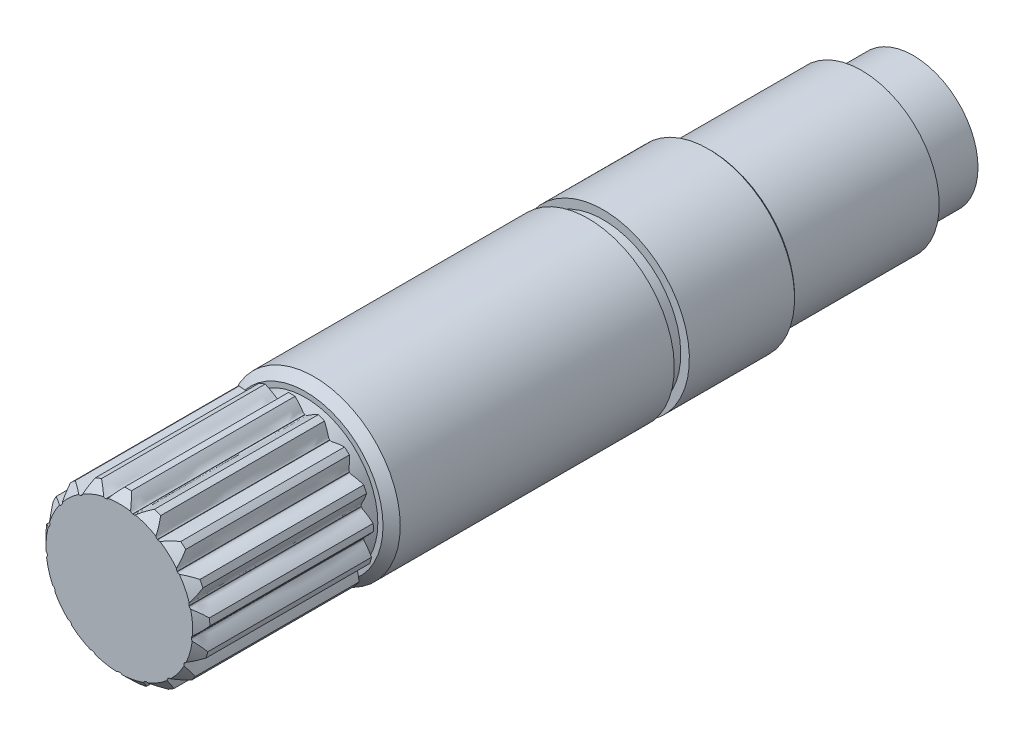
from build123d import *
from OCP.BRepFilletAPI import BRepFilletAPI_MakeChamfer

# Parameters (mm, degrees)
SKETCH12_R              = 10
SHAFT_DEPTH             = 21.5
SKETCH13_R              = 8.398146
MOTOR_SIDE_RELIEF_DEPTH = 1.587
MOTOR_SPLINE_DEPTH      = 20
CHAMFER3_SIZE           = 1
SKETCH23_W              = 1
SKETCH23_H              = 1.75
CHAMFER4_SIZE           = 1
CHAMFER4_SIZE2          = 0.466307658
CHAMFER5_SIZE           = 0.25
CHAMFER6_SIZE           = 1


with BuildPart() as part:
    # Sketch12 → Shaft (new, symmetric)
    with BuildSketch(Plane.XY):
        Circle(SKETCH12_R)
    extrude(amount=SHAFT_DEPTH, both=True)

    # Sketch13 → Motor side relief (add)
    with BuildSketch(Plane.XY.offset(21.5)):
        Circle(SKETCH13_R)
    extrude(amount=MOTOR_SIDE_RELIEF_DEPTH)

    # Sketch15 → Motor spline (add)
    with BuildSketch(Plane.XY.offset(23.087)):
        with BuildLine():
            Line((4.440221189, 7.12834427), (4.421054163, 7.140247638))
            Line((4.421054163, 7.140247638), (4.401855226, 7.152099468))
            add(Edge.make_bspline(
                [(4.401855226, 7.152099468), (4.346074893, 7.18643022), (4.303271658, 7.233316124), (4.247234181, 7.342487901), (4.237804809, 7.408052721), (4.194006084, 7.602023317), (4.124459498, 7.868486133), (3.983153486, 8.288727427), (3.862105942, 8.580360972), (3.794372065, 8.728433243)],
                knots=[0, 0, 0, 0, 0.125, 0.125, 0.25, 0.25, 0.5, 0.75, 1, 1, 1, 1], degree=3, weights=[1, 1, 1, 1, 1, 1, 1, 1, 1, 1]))
            ThreePointArc((3.794372065, 8.728433243), (3.438117558, 8.874804443), (3.076232661, 9.006641931))
            add(Edge.make_bspline(
                [(3.076232661, 9.006641931), (2.926421077, 8.942847219), (2.64049232, 8.808876568), (2.252952462, 8.593511743), (2.022042097, 8.443446649), (1.858997303, 8.329607659), (1.80785818, 8.287507199), (1.692897433, 8.244580486), (1.629678632, 8.238767738), (1.56532799, 8.250975974)],
                knots=[0, 0, 0, 0, 0.25, 0.5, 0.75, 0.75, 0.875, 0.875, 1, 1, 1, 1], degree=3, weights=[1, 1, 1, 1, 1, 1, 1, 1, 1, 1]))
            Line((1.56532799, 8.250975974), (1.543155278, 8.255151605))
            Line((1.543155278, 8.255151605), (1.520971428, 8.259267652))
            add(Edge.make_bspline(
                [(1.520971428, 8.259267652), (1.456556118, 8.271129944), (1.399706148, 8.299387436), (1.308015362, 8.380944015), (1.27553799, 8.438675107), (1.164626634, 8.603725376), (1.003518902, 8.827071428), (0.719946305, 9.167889145), (0.501722644, 9.39610191), (0.38507281, 9.509706892)],
                knots=[0, 0, 0, 0, 0.125, 0.125, 0.25, 0.25, 0.5, 0.75, 1, 1, 1, 1], degree=3, weights=[1, 1, 1, 1, 1, 1, 1, 1, 1, 1]))
            ThreePointArc((0.38507281, 9.509706892), (0, 9.5175), (-0.38507281, 9.509706892))
            add(Edge.make_bspline(
                [(-0.38507281, 9.509706892), (-0.501722644, 9.39610191), (-0.719947489, 9.167888617), (-1.003518896, 8.827071355), (-1.164626634, 8.603725376), (-1.27553799, 8.438675107), (-1.308015362, 8.380944015), (-1.399706148, 8.299387436), (-1.456556118, 8.271129944), (-1.520971428, 8.259267652)],
                knots=[0, 0, 0, 0, 0.25, 0.5, 0.75, 0.75, 0.875, 0.875, 1, 1, 1, 1], degree=3, weights=[1, 1, 1, 1, 1, 1, 1, 1, 1, 1]))
            Line((-1.520971428, 8.259267652), (-1.543155278, 8.255151605))
            Line((-1.543155278, 8.255151605), (-1.56532799, 8.250975974))
            add(Edge.make_bspline(
                [(-1.56532799, 8.250975974), (-1.629678632, 8.238767738), (-1.692897433, 8.244580486), (-1.80785818, 8.287507199), (-1.858997303, 8.329607659), (-2.022042097, 8.443446649), (-2.252952482, 8.593511814), (-2.640493614, 8.808876633), (-2.926421077, 8.942847219), (-3.076232661, 9.006641931)],
                knots=[0, 0, 0, 0, 0.125, 0.125, 0.25, 0.25, 0.5, 0.75, 1, 1, 1, 1], degree=3, weights=[1, 1, 1, 1, 1, 1, 1, 1, 1, 1]))
            ThreePointArc((-3.076232661, 9.006641931), (-3.438117558, 8.874804443), (-3.794372065, 8.728433243))
            add(Edge.make_bspline(
                [(-3.794372065, 8.728433243), (-3.862105942, 8.580360972), (-3.9831544, 8.288726508), (-4.124459466, 7.868486068), (-4.194006084, 7.602023317), (-4.237804809, 7.408052721), (-4.247234181, 7.342487901), (-4.303271658, 7.233316124), (-4.346074893, 7.18643022), (-4.401855226, 7.152099468)],
                knots=[0, 0, 0, 0, 0.25, 0.5, 0.75, 0.75, 0.875, 0.875, 1, 1, 1, 1], degree=3, weights=[1, 1, 1, 1, 1, 1, 1, 1, 1, 1]))
            Line((-4.401855226, 7.152099468), (-4.421054163, 7.140247638))
            Line((-4.421054163, 7.140247638), (-4.440221189, 7.12834427))
            add(Edge.make_bspline(
                [(-4.440221189, 7.12834427), (-4.495816252, 7.093714296), (-4.556865835, 7.076297257), (-4.679570456, 7.074796613), (-4.742464709, 7.095580541), (-4.935622837, 7.142833664), (-5.20515015, 7.199350811), (-5.644320239, 7.260176519), (-5.959335416, 7.281811458), (-6.122075865, 7.287180068)],
                knots=[0, 0, 0, 0, 0.125, 0.125, 0.25, 0.25, 0.5, 0.75, 1, 1, 1, 1], degree=3, weights=[1, 1, 1, 1, 1, 1, 1, 1, 1, 1]))
            ThreePointArc((-6.122075865, 7.287180068), (-6.411898288, 7.03351737), (-6.691220346, 6.768336319))
            add(Edge.make_bspline(
                [(-6.691220346, 6.768336319), (-6.700890432, 6.605794739), (-6.708414237, 6.290125953), (-6.688368931, 5.847218136), (-6.656961773, 5.573625885), (-6.627732607, 5.376931766), (-6.612840489, 5.312388111), (-6.625656486, 5.190345388), (-6.648632171, 5.131163273), (-6.688244085, 5.07900062)],
                knots=[0, 0, 0, 0, 0.25, 0.5, 0.75, 0.75, 0.875, 0.875, 1, 1, 1, 1], degree=3, weights=[1, 1, 1, 1, 1, 1, 1, 1, 1, 1]))
            Line((-6.688244085, 5.07900062), (-6.701865185, 5.061013661))
            Line((-6.701865185, 5.061013661), (-6.715437913, 5.042990172))
            add(Edge.make_bspline(
                [(-6.715437913, 5.042990172), (-6.754768975, 4.990615431), (-6.805404256, 4.952320872), (-6.919280812, 4.906595542), (-6.985435977, 4.903255953), (-7.182620365, 4.877541414), (-7.454363447, 4.832877588), (-7.88585014, 4.730949337), (-8.187408485, 4.637326709), (-8.3410988, 4.583544158)],
                knots=[0, 0, 0, 0, 0.125, 0.125, 0.25, 0.25, 0.5, 0.75, 1, 1, 1, 1], degree=3, weights=[1, 1, 1, 1, 1, 1, 1, 1, 1, 1]))
            ThreePointArc((-8.3410988, 4.583544158), (-8.519716625, 4.242314801), (-8.684382243, 3.89413807))
            add(Edge.make_bspline(
                [(-8.684382243, 3.89413807), (-8.634682538, 3.739079323), (-8.527665559, 3.442009035), (-8.34897711, 3.036250994), (-8.220857887, 2.792479392), (-8.12254839, 2.619626382), (-8.085346046, 2.564820869), (-8.05320969, 2.446389747), (-8.053254834, 2.382904293), (-8.071348519, 2.319954594)],
                knots=[0, 0, 0, 0, 0.25, 0.5, 0.75, 0.75, 0.875, 0.875, 1, 1, 1, 1], degree=3, weights=[1, 1, 1, 1, 1, 1, 1, 1, 1, 1]))
            Line((-8.071348519, 2.319954594), (-8.077552178, 2.298261745))
            Line((-8.077552178, 2.298261745), (-8.083697534, 2.276552308))
            add(Edge.make_bspline(
                [(-8.083697534, 2.276552308), (-8.101452719, 2.213506297), (-8.134835122, 2.159506112), (-8.224503954, 2.075731554), (-8.284985409, 2.048719478), (-8.459565212, 1.953510168), (-8.696823654, 1.813697467), (-9.062352282, 1.562781232), (-9.30972667, 1.366545292), (-9.433610123, 1.260875211)],
                knots=[0, 0, 0, 0, 0.125, 0.125, 0.25, 0.25, 0.5, 0.75, 1, 1, 1, 1], degree=3, weights=[1, 1, 1, 1, 1, 1, 1, 1, 1, 1]))
            ThreePointArc((-9.433610123, 1.260875211), (-9.476900023, 0.878164111), (-9.504670196, 0.494014896))
            add(Edge.make_bspline(
                [(-9.504670196, 0.494014896), (-9.402312921, 0.367380525), (-9.195208395, 0.129029723), (-8.882009667, -0.184778668), (-8.67448159, -0.365806916), (-8.520369004, -0.491474062), (-8.465880817, -0.529139644), (-8.393132302, -0.627964385), (-8.370240806, -0.687179116), (-8.364372611, -0.752414155)],
                knots=[0, 0, 0, 0, 0.25, 0.5, 0.75, 0.75, 0.875, 0.875, 1, 1, 1, 1], degree=3, weights=[1, 1, 1, 1, 1, 1, 1, 1, 1, 1]))
            Line((-8.364372611, -0.752414155), (-8.36232099, -0.774883154))
            Line((-8.36232099, -0.774883154), (-8.360209011, -0.79734656))
            add(Edge.make_bspline(
                [(-8.360209011, -0.79734656), (-8.353990381, -0.862549127), (-8.365611428, -0.924961915), (-8.418962263, -1.035471482), (-8.465601653, -1.082507914), (-8.593998901, -1.234353451), (-8.764729637, -1.450432547), (-9.014933532, -1.816449138), (-9.174714682, -2.088795639), (-9.252060125, -2.23208192)],
                knots=[0, 0, 0, 0, 0.125, 0.125, 0.25, 0.25, 0.5, 0.75, 1, 1, 1, 1], degree=3, weights=[1, 1, 1, 1, 1, 1, 1, 1, 1, 1]))
            ThreePointArc((-9.252060125, -2.23208192), (-9.154175559, -2.604587508), (-9.041299772, -2.972827726))
            add(Edge.make_bspline(
                [(-9.041299772, -2.972827726), (-8.900108844, -3.053935048), (-8.620887383, -3.201375768), (-8.215477602, -3.380852948), (-7.956568487, -3.474688973), (-7.767466572, -3.53619821), (-7.703051473, -3.551636916), (-7.599515889, -3.617508448), (-7.556779376, -3.664455177), (-7.527741833, -3.723165203)],
                knots=[0, 0, 0, 0, 0.25, 0.5, 0.75, 0.75, 0.875, 0.875, 1, 1, 1, 1], degree=3, weights=[1, 1, 1, 1, 1, 1, 1, 1, 1, 1]))
            Line((-7.527741833, -3.723165203), (-7.517712015, -3.74337579))
            Line((-7.517712015, -3.74337579), (-7.507627934, -3.763559357))
            add(Edge.make_bspline(
                [(-7.507627934, -3.763559357), (-7.478275351, -3.822112512), (-7.466565555, -3.88450871), (-7.476393067, -4.006828357), (-7.502891484, -4.067536614), (-7.567765417, -4.255510796), (-7.648910315, -4.518673608), (-7.749998055, -4.950357987), (-7.800606636, -5.262033145), (-7.82096814, -5.423584019)],
                knots=[0, 0, 0, 0, 0.125, 0.125, 0.25, 0.25, 0.5, 0.75, 1, 1, 1, 1], degree=3, weights=[1, 1, 1, 1, 1, 1, 1, 1, 1, 1]))
            ThreePointArc((-7.82096814, -5.423584019), (-7.595128961, -5.735575152), (-7.356851714, -6.038173492))
            add(Edge.make_bspline(
                [(-7.356851714, -6.038173492), (-7.19589575, -6.062799771), (-6.882267761, -6.099417722), (-6.439399763, -6.120324303), (-6.164076721, -6.114295031), (-5.965524738, -6.103339195), (-5.899882343, -6.094465941), (-5.779542744, -6.118487949), (-5.722733018, -6.146826261), (-5.674447808, -6.19108216)],
                knots=[0, 0, 0, 0, 0.25, 0.5, 0.75, 0.75, 0.875, 0.875, 1, 1, 1, 1], degree=3, weights=[1, 1, 1, 1, 1, 1, 1, 1, 1, 1]))
            Line((-5.674447808, -6.19108216), (-5.657794375, -6.206304782))
            Line((-5.657794375, -6.206304782), (-5.641100105, -6.221482608))
            add(Edge.make_bspline(
                [(-5.641100105, -6.221482608), (-5.592577797, -6.265478423), (-5.559118631, -6.319431079), (-5.524095559, -6.437040859), (-5.526874245, -6.503221956), (-5.51946328, -6.701937828), (-5.50006327, -6.97664276), (-5.438382397, -7.415693559), (-5.37298344, -7.724603916), (-5.333611069, -7.882601043)],
                knots=[0, 0, 0, 0, 0.125, 0.125, 0.25, 0.25, 0.5, 0.75, 1, 1, 1, 1], degree=3, weights=[1, 1, 1, 1, 1, 1, 1, 1, 1, 1]))
            ThreePointArc((-5.333611069, -7.882601043), (-5.01031811, -8.091941589), (-4.678820066, -8.288030468))
            add(Edge.make_bspline(
                [(-4.678820066, -8.288030468), (-4.519837062, -8.252849789), (-4.214159742, -8.173699515), (-3.793645304, -8.033211947), (-3.539092238, -7.928131664), (-3.357905732, -7.846190402), (-3.29990141, -7.814203571), (-3.179010326, -7.793131749), (-3.115799855, -7.799034398), (-3.054788163, -7.822859165)],
                knots=[0, 0, 0, 0, 0.25, 0.5, 0.75, 0.75, 0.875, 0.875, 1, 1, 1, 1], degree=3, weights=[1, 1, 1, 1, 1, 1, 1, 1, 1, 1]))
            Line((-3.054788163, -7.822859165), (-3.033760254, -7.831037923))
            Line((-3.033760254, -7.831037923), (-3.012710447, -7.839160159))
            add(Edge.make_bspline(
                [(-3.012710447, -7.839160159), (-2.951571621, -7.862656755), (-2.900881931, -7.900879263), (-2.825738336, -7.997895325), (-2.804422014, -8.060611137), (-2.725727042, -8.24323102), (-2.608402205, -8.492377648), (-2.392283061, -8.879498624), (-2.219709058, -9.143924126), (-2.12592027, -9.277029118)],
                knots=[0, 0, 0, 0, 0.125, 0.125, 0.25, 0.25, 0.5, 0.75, 1, 1, 1, 1], degree=3, weights=[1, 1, 1, 1, 1, 1, 1, 1, 1, 1]))
            ThreePointArc((-2.12592027, -9.277029118), (-1.748836036, -9.355446476), (-1.368887842, -9.418543004))
            add(Edge.make_bspline(
                [(-1.368887842, -9.418543004), (-1.233349333, -9.328306713), (-0.976906098, -9.144077896), (-0.635538026, -8.861169804), (-0.436133737, -8.671230184), (-0.29678295, -8.529370118), (-0.254250507, -8.478589709), (-0.149134948, -8.415269923), (-0.088060657, -8.397939724), (-0.02256245, -8.398115692)],
                knots=[0, 0, 0, 0, 0.25, 0.5, 0.75, 0.75, 0.875, 0.875, 1, 1, 1, 1], degree=3, weights=[1, 1, 1, 1, 1, 1, 1, 1, 1, 1]))
            Line((-0.02256245, -8.398115692), (0, -8.398146))
            Line((0, -8.398146), (0.02256245, -8.398115692))
            add(Edge.make_bspline(
                [(0.02256245, -8.398115692), (0.088060657, -8.397939724), (0.149134948, -8.415269923), (0.254250507, -8.478589709), (0.29678295, -8.529370118), (0.436133737, -8.671230184), (0.635538032, -8.861169877), (0.976907359, -9.144078197), (1.233349333, -9.328306713), (1.368887842, -9.418543004)],
                knots=[0, 0, 0, 0, 0.125, 0.125, 0.25, 0.25, 0.5, 0.75, 1, 1, 1, 1], degree=3, weights=[1, 1, 1, 1, 1, 1, 1, 1, 1, 1]))
            ThreePointArc((1.368887842, -9.418543004), (1.748836036, -9.355446476), (2.12592027, -9.277029118))
            add(Edge.make_bspline(
                [(2.12592027, -9.277029118), (2.219709058, -9.143924126), (2.392284128, -8.879497888), (2.608402185, -8.492377578), (2.725727042, -8.24323102), (2.804422014, -8.060611137), (2.825738336, -7.997895325), (2.900881931, -7.900879263), (2.951571621, -7.862656755), (3.012710447, -7.839160159)],
                knots=[0, 0, 0, 0, 0.25, 0.5, 0.75, 0.75, 0.875, 0.875, 1, 1, 1, 1], degree=3, weights=[1, 1, 1, 1, 1, 1, 1, 1, 1, 1]))
            Line((3.012710447, -7.839160159), (3.033760254, -7.831037923))
            Line((3.033760254, -7.831037923), (3.054788163, -7.822859165))
            add(Edge.make_bspline(
                [(3.054788163, -7.822859165), (3.115799855, -7.799034398), (3.179010326, -7.793131749), (3.29990141, -7.814203571), (3.357905732, -7.846190402), (3.539092238, -7.928131664), (3.793645337, -8.033212013), (4.214161026, -8.17369934), (4.519837062, -8.252849789), (4.678820066, -8.288030468)],
                knots=[0, 0, 0, 0, 0.125, 0.125, 0.25, 0.25, 0.5, 0.75, 1, 1, 1, 1], degree=3, weights=[1, 1, 1, 1, 1, 1, 1, 1, 1, 1]))
            ThreePointArc((4.678820066, -8.288030468), (5.01031811, -8.091941589), (5.333611069, -7.882601043))
            add(Edge.make_bspline(
                [(5.333611069, -7.882601043), (5.37298344, -7.724603916), (5.438383126, -7.415692487), (5.500063226, -6.976642702), (5.51946328, -6.701937828), (5.526874245, -6.503221956), (5.524095559, -6.437040859), (5.559118631, -6.319431079), (5.592577797, -6.265478423), (5.641100105, -6.221482608)],
                knots=[0, 0, 0, 0, 0.25, 0.5, 0.75, 0.75, 0.875, 0.875, 1, 1, 1, 1], degree=3, weights=[1, 1, 1, 1, 1, 1, 1, 1, 1, 1]))
            Line((5.641100105, -6.221482608), (5.657794375, -6.206304782))
            Line((5.657794375, -6.206304782), (5.674447808, -6.19108216))
            add(Edge.make_bspline(
                [(5.674447808, -6.19108216), (5.722733018, -6.146826261), (5.779542744, -6.118487949), (5.899882343, -6.094465941), (5.965524738, -6.103339195), (6.164076721, -6.114295031), (6.439399817, -6.120324352), (6.882268896, -6.099417095), (7.19589575, -6.062799771), (7.356851714, -6.038173492)],
                knots=[0, 0, 0, 0, 0.125, 0.125, 0.25, 0.25, 0.5, 0.75, 1, 1, 1, 1], degree=3, weights=[1, 1, 1, 1, 1, 1, 1, 1, 1, 1]))
            ThreePointArc((7.356851714, -6.038173492), (7.595128961, -5.735575152), (7.82096814, -5.423584019))
            add(Edge.make_bspline(
                [(7.82096814, -5.423584019), (7.800606636, -5.262033145), (7.749998348, -4.950356724), (7.648910253, -4.51867357), (7.567765417, -4.255510796), (7.502891484, -4.067536614), (7.476393067, -4.006828357), (7.466565555, -3.88450871), (7.478275351, -3.822112512), (7.507627934, -3.763559357)],
                knots=[0, 0, 0, 0, 0.25, 0.5, 0.75, 0.75, 0.875, 0.875, 1, 1, 1, 1], degree=3, weights=[1, 1, 1, 1, 1, 1, 1, 1, 1, 1]))
            Line((7.507627934, -3.763559357), (7.517712015, -3.74337579))
            Line((7.517712015, -3.74337579), (7.527741833, -3.723165203))
            add(Edge.make_bspline(
                [(7.527741833, -3.723165203), (7.556779376, -3.664455177), (7.599515889, -3.617508448), (7.703051473, -3.551636916), (7.767466572, -3.53619821), (7.956568487, -3.474688973), (8.21547767, -3.380852974), (8.620888215, -3.201374774), (8.900108844, -3.053935048), (9.041299772, -2.972827726)],
                knots=[0, 0, 0, 0, 0.125, 0.125, 0.25, 0.25, 0.5, 0.75, 1, 1, 1, 1], degree=3, weights=[1, 1, 1, 1, 1, 1, 1, 1, 1, 1]))
            ThreePointArc((9.041299772, -2.972827726), (9.154175559, -2.604587508), (9.252060125, -2.23208192))
            add(Edge.make_bspline(
                [(9.252060125, -2.23208192), (9.174714682, -2.088795639), (9.014933348, -1.816447855), (8.764729565, -1.450432533), (8.593998901, -1.234353451), (8.465601653, -1.082507914), (8.418962263, -1.035471482), (8.365611428, -0.924961915), (8.353990381, -0.862549127), (8.360209011, -0.79734656)],
                knots=[0, 0, 0, 0, 0.25, 0.5, 0.75, 0.75, 0.875, 0.875, 1, 1, 1, 1], degree=3, weights=[1, 1, 1, 1, 1, 1, 1, 1, 1, 1]))
            Line((8.360209011, -0.79734656), (8.36232099, -0.774883154))
            Line((8.36232099, -0.774883154), (8.364372611, -0.752414155))
            add(Edge.make_bspline(
                [(8.364372611, -0.752414155), (8.370240806, -0.687179116), (8.393132302, -0.627964385), (8.465880817, -0.529139644), (8.520369004, -0.491474062), (8.67448159, -0.365806916), (8.88200974, -0.184778668), (9.195208811, 0.12903095), (9.402312921, 0.367380525), (9.504670196, 0.494014896)],
                knots=[0, 0, 0, 0, 0.125, 0.125, 0.25, 0.25, 0.5, 0.75, 1, 1, 1, 1], degree=3, weights=[1, 1, 1, 1, 1, 1, 1, 1, 1, 1]))
            ThreePointArc((9.504670196, 0.494014896), (9.476900023, 0.878164111), (9.433610123, 1.260875211))
            add(Edge.make_bspline(
                [(9.433610123, 1.260875211), (9.30972667, 1.366545292), (9.062351647, 1.562782362), (8.696823583, 1.813697454), (8.459565212, 1.953510168), (8.284985409, 2.048719478), (8.224503954, 2.075731554), (8.134835122, 2.159506112), (8.101452719, 2.213506297), (8.083697534, 2.276552308)],
                knots=[0, 0, 0, 0, 0.25, 0.5, 0.75, 0.75, 0.875, 0.875, 1, 1, 1, 1], degree=3, weights=[1, 1, 1, 1, 1, 1, 1, 1, 1, 1]))
            Line((8.083697534, 2.276552308), (8.077552178, 2.298261745))
            Line((8.077552178, 2.298261745), (8.071348519, 2.319954594))
            add(Edge.make_bspline(
                [(8.071348519, 2.319954594), (8.053254834, 2.382904293), (8.05320969, 2.446389747), (8.085346046, 2.564820869), (8.12254839, 2.619626382), (8.220857887, 2.792479392), (8.348977178, 3.036251021), (8.527665504, 3.442010329), (8.634682538, 3.739079323), (8.684382243, 3.89413807)],
                knots=[0, 0, 0, 0, 0.125, 0.125, 0.25, 0.25, 0.5, 0.75, 1, 1, 1, 1], degree=3, weights=[1, 1, 1, 1, 1, 1, 1, 1, 1, 1]))
            ThreePointArc((8.684382243, 3.89413807), (8.519716625, 4.242314801), (8.3410988, 4.583544158))
            add(Edge.make_bspline(
                [(8.3410988, 4.583544158), (8.187408485, 4.637326709), (7.88584914, 4.730950162), (7.454363385, 4.83287755), (7.182620365, 4.877541414), (6.985435977, 4.903255953), (6.919280812, 4.906595542), (6.805404256, 4.952320872), (6.754768975, 4.990615431), (6.715437913, 5.042990172)],
                knots=[0, 0, 0, 0, 0.25, 0.5, 0.75, 0.75, 0.875, 0.875, 1, 1, 1, 1], degree=3, weights=[1, 1, 1, 1, 1, 1, 1, 1, 1, 1]))
            Line((6.715437913, 5.042990172), (6.701865185, 5.061013661))
            Line((6.701865185, 5.061013661), (6.688244085, 5.07900062))
            add(Edge.make_bspline(
                [(6.688244085, 5.07900062), (6.648632171, 5.131163273), (6.625656486, 5.190345388), (6.612840489, 5.312388111), (6.627732607, 5.376931766), (6.656961773, 5.573625885), (6.688368985, 5.847218185), (6.708413718, 6.290127141), (6.700890432, 6.605794739), (6.691220346, 6.768336319)],
                knots=[0, 0, 0, 0, 0.125, 0.125, 0.25, 0.25, 0.5, 0.75, 1, 1, 1, 1], degree=3, weights=[1, 1, 1, 1, 1, 1, 1, 1, 1, 1]))
            ThreePointArc((6.691220346, 6.768336319), (6.411898288, 7.03351737), (6.122075865, 7.287180068))
            add(Edge.make_bspline(
                [(6.122075865, 7.287180068), (5.959335416, 7.281811458), (5.644319009, 7.260176927), (5.205150106, 7.199350753), (4.935622837, 7.142833664), (4.742464709, 7.095580541), (4.679570456, 7.074796613), (4.556865835, 7.076297257), (4.495816252, 7.093714296), (4.440221189, 7.12834427)],
                knots=[0, 0, 0, 0, 0.25, 0.5, 0.75, 0.75, 0.875, 0.875, 1, 1, 1, 1], degree=3, weights=[1, 1, 1, 1, 1, 1, 1, 1, 1, 1]))
        make_face()
    extrude(amount=MOTOR_SPLINE_DEPTH)

    # Chamfer3
    chamfer3_edges = [part.edges().sort_by_distance(p)[0] for p in [
        (-10, 0, 21.5),
    ]]
    chamfer(chamfer3_edges, length=CHAMFER3_SIZE)

    # Sketch23 → snap ring (revolve, cut)
    with BuildSketch(Plane(origin=(0, 0, -31.5), x_dir=(-0.3181828922838932, -0.9480293492597455, 0), z_dir=(-0.9480293492597455, 0.3181828922838932, 0))):
        with Locations((9.5, 19.32924121)):
            Rectangle(SKETCH23_W, SKETCH23_H)
    revolve(axis=Axis((0, 0, 153.83579317), (0, 0, -1)), mode=Mode.SUBTRACT)

    # Sketch24 → Revolve1 (revolve)
    with BuildSketch(Plane(origin=(0, 0, 0), x_dir=(1, 0, 0), z_dir=(0, 1, 0))):
        Polygon((10, 21.5), (10, 25.5), (9, 25.5), (9, 43.5), (7.5, 43.5), (7.5, 49.5), (0, 49.5), (0, 21.5), align=None)
    revolve(axis=Axis((0, 0, 0), (0, 0, -1)))

    # Chamfer4: one chamfer whose edges measure the first distance from different faces: ONE call of the kernel's chamfer builder (chamfer() names one face for all edges)
    chamfer4_edges_1 = [part.edges().sort_by_distance(p)[0] for p in [
        (-9, 0, -43.5),
    ]]
    chamfer4_side_1 = [part.faces().sort_by_distance(p)[0] for p in [
        (-8.745441559, 0, -43.5),
    ]]
    chamfer4_edges_2 = [part.edges().sort_by_distance(p)[0] for p in [
        (-7.5, 0, -49.5),
    ]]
    chamfer4_side_2 = [part.faces().sort_by_distance(p)[0] for p in [
        (0, 0, -49.5),
    ]]
    chamfer4 = BRepFilletAPI_MakeChamfer(part.part.solid().wrapped)
    for e in chamfer4_edges_1:
        chamfer4.Add(CHAMFER4_SIZE, CHAMFER4_SIZE2, e.wrapped, chamfer4_side_1[0].wrapped)  # the first distance lies on this face
    for e in chamfer4_edges_2:
        chamfer4.Add(CHAMFER4_SIZE, CHAMFER4_SIZE2, e.wrapped, chamfer4_side_2[0].wrapped)  # the first distance lies on this face
    add(Compound.cast(chamfer4.Shape()), mode=Mode.REPLACE)

    # Chamfer5
    chamfer5_edges = [part.edges().sort_by_distance(p)[0] for p in [
        (-10, 0, -25.5),
    ]]
    chamfer(chamfer5_edges, length=CHAMFER5_SIZE)

    # Chamfer6
    chamfer6_edges = [part.edges().sort_by_distance(p)[0] for p in [
        (-7.595128961, -5.735575152, 43.087),
        (-5.01031811, -8.091941589, 43.087),
        (-1.748836036, -9.355446476, 43.087),
        (1.748836036, -9.355446476, 43.087),
        (5.01031811, -8.091941589, 43.087),
        (7.595128961, -5.735575152, 43.087),
        (9.154175559, -2.604587508, 43.087),
        (9.476900023, 0.878164111, 43.087),
        (8.519716625, 4.242314801, 43.087),
        (6.411898288, 7.03351737, 43.087),
        (3.438117558, 8.874804443, 43.087),
        (0, 9.5175, 43.087),
        (-3.438117558, 8.874804443, 43.087),
        (-9.154175559, -2.604587508, 43.087),
        (-9.476900023, 0.878164111, 43.087),
        (-8.519716625, 4.242314801, 43.087),
        (-6.411898288, 7.03351737, 43.087),
    ]]
    chamfer(chamfer6_edges, length=CHAMFER6_SIZE)


solid = part.part
